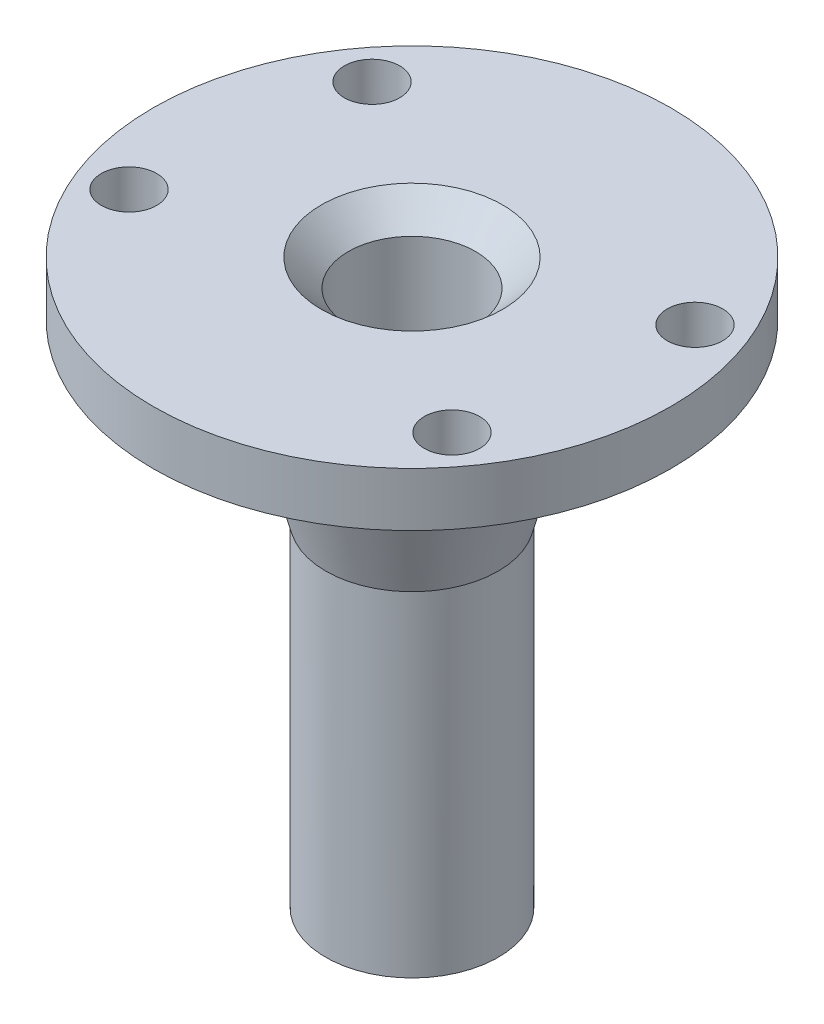
from build123d import *

# Parameters (mm, degrees)
SKETCH5_R                       = 7.5
CUT_EXTRUDE1_DEPTH              = 90
SKETCH6_R                       = 3.5
CUT_EXTRUDE2_DEPTH              = 20
CIRPATTERN1_COUNT               = 6
SKETCH11_R                      = 3.18
CUT_EXTRUDE4_DEPTH              = 101.105860558
SKETCH23_R                      = 30.48
CUT_EXTRUDE6_DEPTH              = 80.122584091
F_1_4_CLEARANCE_HOLE1_D         = 6.5278
F_1_4_CLEARANCE_HOLE1_DEPTH     = 15.4203
F_1_4_CLEARANCE_HOLE1_TIP       = 1.961148974
CHAMFER1_SIZE                   = 3.175
SKETCH26_OUTSIDE_W              = 84.718
SKETCH26_OUTSIDE_H              = 84.718
SKETCH26_OUTSIDE_R              = 15
FOR_TURNING_EASE_DEPTH          = 74.878689756
F_1_16_0_0625_DOWEL_HOLE1_D     = 1.5875
F_1_16_0_0625_DOWEL_HOLE1_DEPTH = 6
F_1_16_0_0625_DOWEL_HOLE1_TIP   = 0.476933116


with BuildPart() as part:
    # Sketch1 → Revolve1 (revolve)
    with BuildSketch(Plane(origin=(0, 0, 0), x_dir=(0, 0, -1), z_dir=(1, 0, 0))):
        Polygon((0, 30.35), (12.7, 30.35), (12.7, 6.35), (30.48, 6.35), (30.48, 0), (15.68, 0), (10.16, -20.600920458), (10.16, -60), (0, -60), align=None)
    revolve(axis=Axis((0, 0, 0), (0, 1, 0)))

    # Sketch5 → Cut-Extrude1 (cut)
    with BuildSketch(Plane.XZ.offset(60)):
        Circle(SKETCH5_R)
    extrude(amount=-CUT_EXTRUDE1_DEPTH, mode=Mode.SUBTRACT)

    # Sketch6 → Cut-Extrude2 (cut, symmetric)
    with BuildSketch(Plane.XY):
        with Locations((0, 16.659966967)):
            Circle(SKETCH6_R)
    cut_extrude2 = extrude(amount=CUT_EXTRUDE2_DEPTH, both=True, mode=Mode.SUBTRACT)

    # CirPattern1: Cut-Extrude2 ×6 about axis
    cirpattern1_axis = Axis((0, 30.35, 0), (0, -1, 0))
    for i in range(1, CIRPATTERN1_COUNT):
        add(cut_extrude2.rotate(cirpattern1_axis, i * 360 / CIRPATTERN1_COUNT), mode=Mode.SUBTRACT)

    # Sketch11 → Cut-Extrude4 (cut, through all)
    with BuildSketch(Plane(origin=(0, 30.35, 0), x_dir=(1, 0, 0), z_dir=(0, 1, 0))):
        Circle(SKETCH11_R)
    extrude(amount=-CUT_EXTRUDE4_DEPTH, mode=Mode.SUBTRACT)

    # Sketch23 → Cut-Extrude6 (cut, through all)
    with BuildSketch(Plane(origin=(0, 6.35, 0), x_dir=(1, 0, 0), z_dir=(0, 1, 0))):
        Circle(SKETCH23_R)
    extrude(amount=CUT_EXTRUDE6_DEPTH, mode=Mode.SUBTRACT)

    # 1/4 Clearance Hole1
    with Locations(Plane(origin=(0, 6.35, 0), x_dir=(1, 0, 0), z_dir=(0, 1, 0))):
        with Locations((-20.240427094, 15.531025958), (23.570476573, 9.763211068), (20.240427094, -15.531025958), (-23.570476573, -9.763211068)):
            Hole(F_1_4_CLEARANCE_HOLE1_D / 2, depth=F_1_4_CLEARANCE_HOLE1_DEPTH)
            with Locations((0, 0, -(F_1_4_CLEARANCE_HOLE1_DEPTH + F_1_4_CLEARANCE_HOLE1_TIP / 2))):  # 118° drill point
                Cone(0, F_1_4_CLEARANCE_HOLE1_D / 2, F_1_4_CLEARANCE_HOLE1_TIP, mode=Mode.SUBTRACT)

    # Chamfer1
    chamfer1_edges = [part.edges().sort_by_distance(p)[0] for p in [
        (-7.5, 6.35, 0),
    ]]
    chamfer(chamfer1_edges, length=CHAMFER1_SIZE)

    # Sketch26 outside → for-turning-ease (cut, through all)
    with BuildSketch(Plane.XZ):
        Rectangle(SKETCH26_OUTSIDE_W, SKETCH26_OUTSIDE_H)
        Circle(SKETCH26_OUTSIDE_R, mode=Mode.SUBTRACT)
    extrude(amount=FOR_TURNING_EASE_DEPTH, mode=Mode.SUBTRACT)

    # 1/16 (0.0625) Dowel Hole1
    with Locations(Plane(origin=(0, -60, 0), x_dir=(-1, 0, 0), z_dir=(0, -1, 0))):
        with Locations((8.83, 0), (-8.83, 0)):
            Hole(F_1_16_0_0625_DOWEL_HOLE1_D / 2, depth=F_1_16_0_0625_DOWEL_HOLE1_DEPTH)
            with Locations((0, 0, -(F_1_16_0_0625_DOWEL_HOLE1_DEPTH + F_1_16_0_0625_DOWEL_HOLE1_TIP / 2))):  # 118° drill point
                Cone(0, F_1_16_0_0625_DOWEL_HOLE1_D / 2, F_1_16_0_0625_DOWEL_HOLE1_TIP, mode=Mode.SUBTRACT)


solid = part.part
